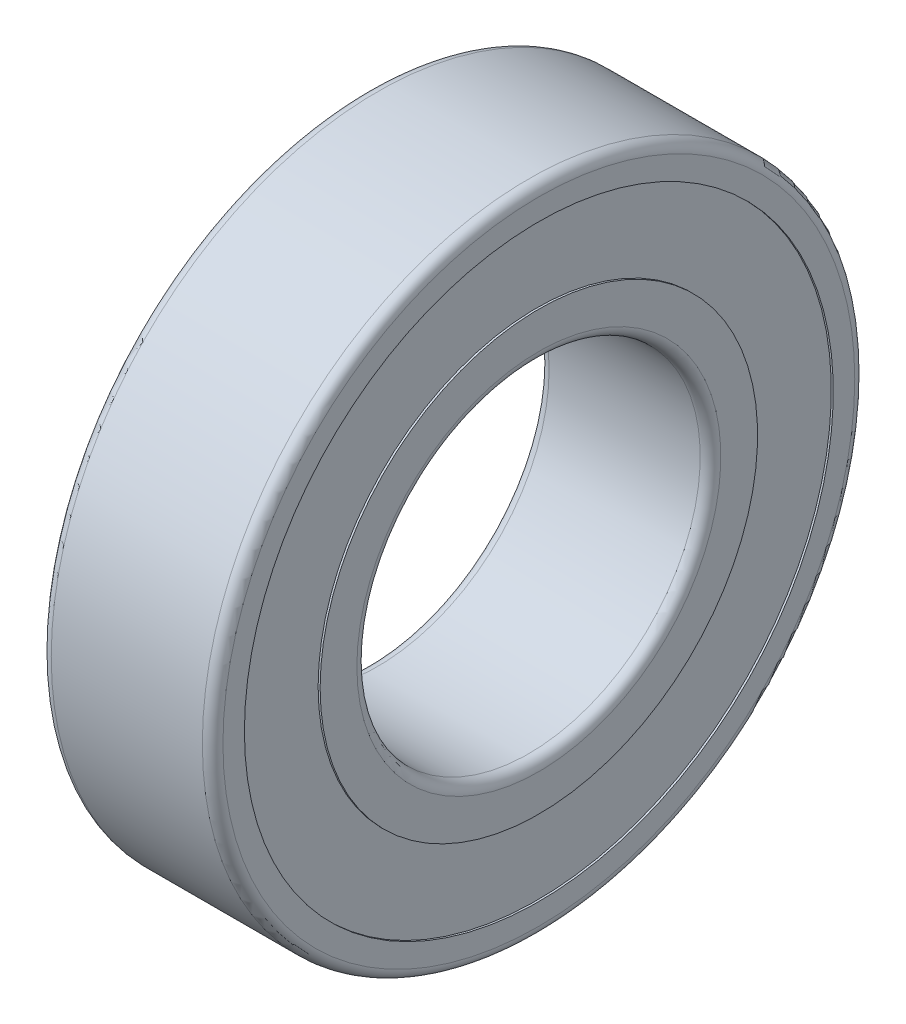
from build123d import *

# Parameters (mm, degrees)
FILLET1_R = 0.3
FILLET2_R = 0.3


with BuildPart() as part:
    # Sketch1 → Revolve1 (revolve)
    with BuildSketch(Plane.XY):
        Polygon((0, 5), (5, 5), (5, 6.37), (4.942, 6.37), (4.942, 8.575), (5, 8.575), (5, 9.5), (0, 9.5), (0, 8.575), (0.058, 8.575), (0.058, 6.37), (0, 6.37), align=None)
    revolve(axis=Axis((0, 0, 0), (1, 0, 0)))

    # Fillet1
    fillet1_edges = [part.edges().sort_by_distance(p)[0] for p in [
        (5, -9.5, 0),
        (0, -9.5, 0),
    ]]
    fillet(fillet1_edges, radius=FILLET1_R)

    # Fillet2
    fillet2_edges = [part.edges().sort_by_distance(p)[0] for p in [
        (5, -5, 0),
        (0, -5, 0),
    ]]
    fillet(fillet2_edges, radius=FILLET2_R)


solid = part.part
